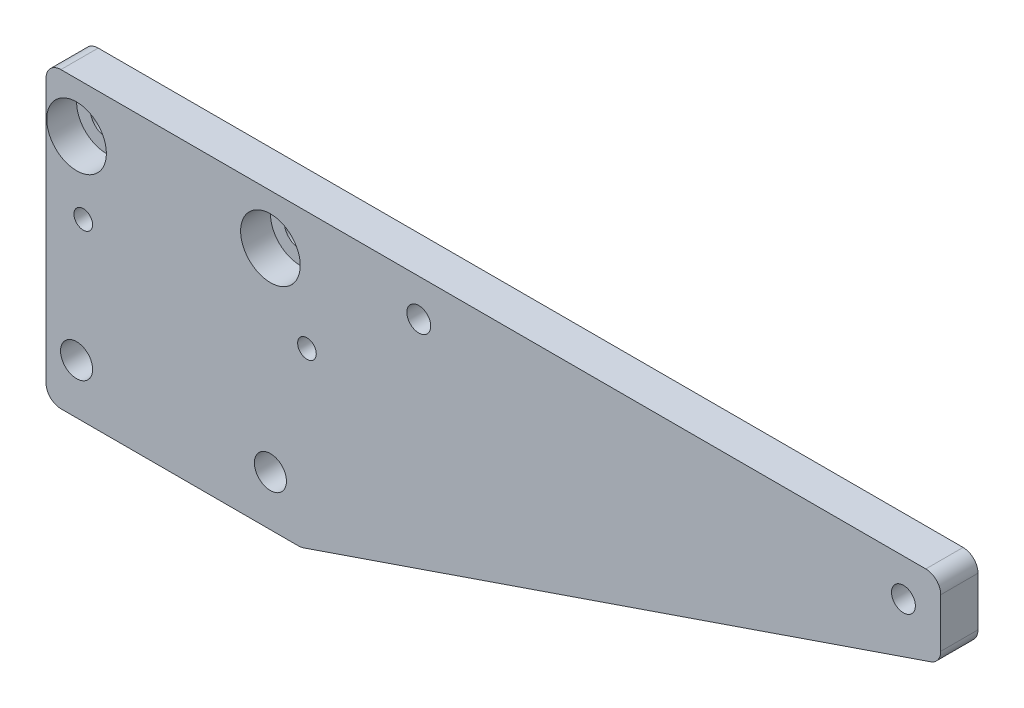
from build123d import *

# Parameters (mm, degrees)
BOSS_EXTRUDE1_DEPTH            = 5
CBORE_FOR_M4_SHCS1_D           = 4.3
CBORE_FOR_M4_SHCS1_CBORE_D     = 8
CBORE_FOR_M4_SHCS1_CBORE_DEPTH = 4
M4_CLEARANCE_HOLE1_D           = 4.3
TAP_DRILL_FOR_M3X0_5_TAP1_D    = 2.5
M3_CLEARANCE_HOLE2_D           = 3.2
FILLET1_R                      = 2


with BuildPart() as part:
    # Sketch1 → Boss-Extrude1 (new body)
    with BuildSketch(Plane.XY):
        Polygon((17.1, 19.7), (102.9, 19.7), (102.9, 9.7), (17.1, -19.7), (-17.1, -19.7), (-17.1, 19.7), align=None)
    extrude(amount=BOSS_EXTRUDE1_DEPTH)

    # CBORE for M4 SHCS1 (through all)
    with Locations(Plane.XY.offset(5)):
        with Locations((13, 13), (-13, 13)):
            CounterBoreHole(CBORE_FOR_M4_SHCS1_D / 2, CBORE_FOR_M4_SHCS1_CBORE_D / 2, CBORE_FOR_M4_SHCS1_CBORE_DEPTH)

    # M4 Clearance Hole1 (through all)
    with Locations(Plane.XY.offset(5)):
        with Locations((-13, -13), (13, -13)):
            Hole(M4_CLEARANCE_HOLE1_D / 2)

    # Tap Drill for M3x0.5 Tap1 (through all)
    with Locations(Plane.XY.offset(5)):
        with Locations((-12.1, 3.8), (17.9, 3.8)):
            Hole(TAP_DRILL_FOR_M3X0_5_TAP1_D / 2)

    # M3 Clearance Hole2 (through all)
    with Locations(Plane(origin=(0, 0, 0), x_dir=(-1, 0, 0), z_dir=(0, 0, -1))):
        with Locations((-97.9, 14.7), (-32.9, 14.7)):
            Hole(M3_CLEARANCE_HOLE2_D / 2)

    # Fillet1
    fillet1_edges = [part.edges().sort_by_distance(p)[0] for p in [
        (17.1, -19.7, 2.5),
        (-17.1, -19.7, 2.5),
        (102.9, 19.7, 2.5),
        (-17.1, 19.7, 2.5),
        (102.9, 9.7, 2.5),
    ]]
    fillet(fillet1_edges, radius=FILLET1_R)


solid = part.part
